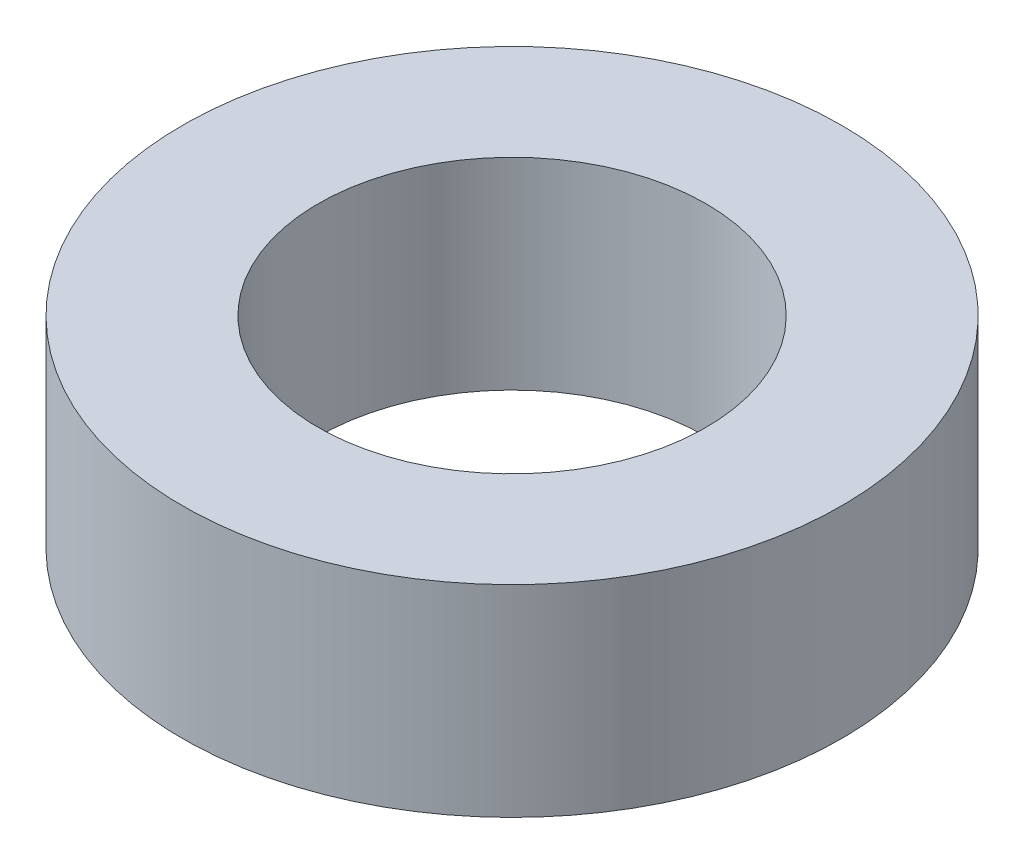
from build123d import *

# Parameters (mm, degrees)
SKETCH1_R           = 42.5
BOSS_EXTRUDE1_DEPTH = 26
SKETCH2_R           = 25
CUT_EXTRUDE1_DEPTH  = 66.486639859


with BuildPart() as part:
    # Sketch1 → Boss-Extrude1 (new body)
    with BuildSketch(Plane(origin=(0, 0, 0), x_dir=(1, 0, 0), z_dir=(0, 1, 0))):
        Circle(SKETCH1_R)
    extrude(amount=BOSS_EXTRUDE1_DEPTH)

    # Sketch2 → Cut-Extrude1 (cut, through all)
    with BuildSketch(Plane(origin=(0, 0, 0), x_dir=(1, 0, 0), z_dir=(0, 1, 0))):
        Circle(SKETCH2_R)
    extrude(amount=CUT_EXTRUDE1_DEPTH, mode=Mode.SUBTRACT)


solid = part.part
